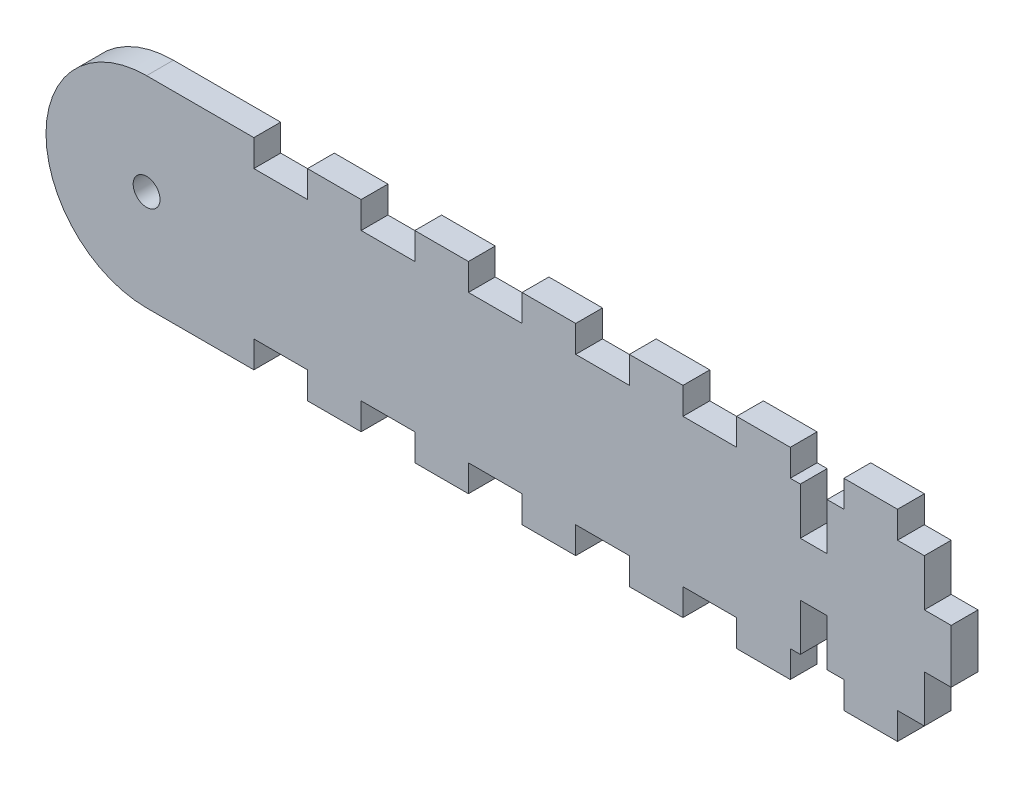
from build123d import *

# Parameters (mm, degrees)
MASS_DEPTH          = 6.35
SKETCH4_R           = 3.175
CUT_EXTRUDE1_DEPTH  = 122.586333782
SKETCH3_W           = 12.7
SKETCH3_H           = 12.7
CUT_EXTRUDE2_DEPTH  = 122.586333782
LPATTERN1_COUNT     = 7
LPATTERN1_PITCH     = 25.4
CAVITY1_START       = 59.53125
CAVITY1_OUTLINE_W   = 11.1125
CAVITY1_OUTLINE_H   = 6.35
CAVITY1_DEPTH       = 6.35
CAVITY1_START_2     = 88.9
CAVITY1_2_OUTLINE_W = 11.1125
CAVITY1_2_OUTLINE_H = 6.35
CAVITY1_2_DEPTH     = 6.35


# Read off the part's stored shape, not the designer's step: Cavity1
with BuildPart() as part:
    # Sketch1 → Mass (new body)
    with BuildSketch(Plane.XY):
        with BuildLine():
            Line((-95.25, -23.8125), (95.25, -23.8125))
            Line((95.25, -23.8125), (95.25, 23.8125))
            Line((95.25, 23.8125), (-95.25, 23.8125))
            ThreePointArc((-95.25, 23.8125), (-119.0625, 0), (-95.25, -23.8125))
        make_face()
    extrude(amount=MASS_DEPTH)

    # Sketch4 → Cut-Extrude1 (cut, through all)
    with BuildSketch(Plane(origin=(0, 0, 0), x_dir=(-1, 0, 0), z_dir=(0, 0, -1))):
        with Locations((95.25, 0)):
            Circle(SKETCH4_R)
    extrude(amount=-CUT_EXTRUDE1_DEPTH, mode=Mode.SUBTRACT)

    # Sketch3 → Cut-Extrude2 (cut, through all)
    with BuildSketch(Plane(origin=(0, 0, 0), x_dir=(-1, 0, 0), z_dir=(0, 0, -1))):
        with Locations((-88.9, 23.8125)):
            Rectangle(SKETCH3_W, SKETCH3_H)
        with Locations((-88.9, -23.8125)):
            Rectangle(SKETCH3_W, SKETCH3_H)
    cut_extrude2 = extrude(amount=-CUT_EXTRUDE2_DEPTH, mode=Mode.SUBTRACT)

    # LPattern1: Cut-Extrude2 ×7
    with Locations(*[(-i * LPATTERN1_PITCH, 0, 0) for i in range(1, LPATTERN1_COUNT)]):
        add(cut_extrude2, mode=Mode.SUBTRACT)

    # Cavity1 outline → Cavity1 (cut)
    with BuildSketch(Plane.YZ.offset(CAVITY1_START)):
        with Locations((-11.90625, 3.175)):
            Rectangle(CAVITY1_OUTLINE_W, CAVITY1_OUTLINE_H)
        with Locations((11.90625, 3.175)):
            Rectangle(CAVITY1_OUTLINE_W, CAVITY1_OUTLINE_H)
    extrude(amount=CAVITY1_DEPTH, mode=Mode.SUBTRACT)

    # Cavity1 2 outline → Cavity1 2 (cut)
    with BuildSketch(Plane.YZ.offset(CAVITY1_START_2)):
        with Locations((-11.90625, 3.175)):
            Rectangle(CAVITY1_2_OUTLINE_W, CAVITY1_2_OUTLINE_H)
        with Locations((11.90625, 3.175)):
            Rectangle(CAVITY1_2_OUTLINE_W, CAVITY1_2_OUTLINE_H)
    extrude(amount=CAVITY1_2_DEPTH, mode=Mode.SUBTRACT)


solid = part.part
